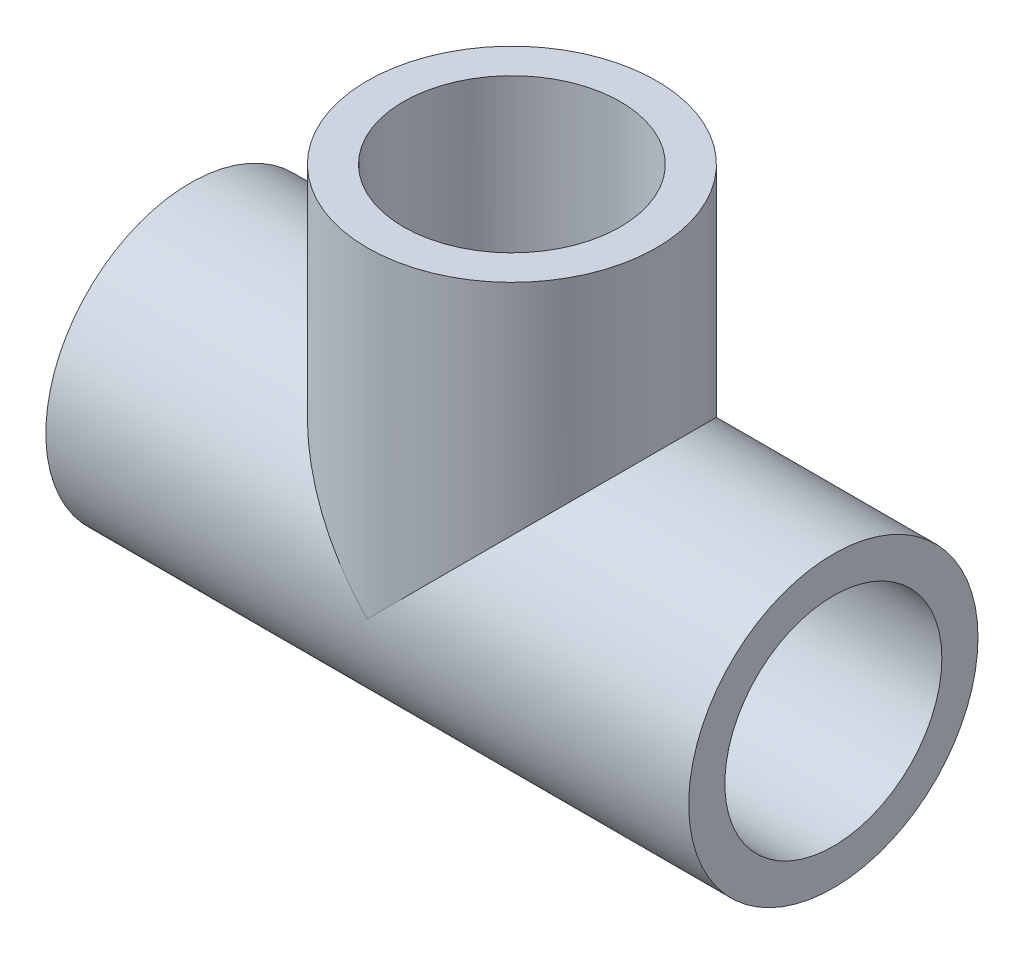
from build123d import *
from build123d.topology import SkipClean

# Parameters (mm, degrees)
SKETCH4_R              = 7.8613
CUT_EXTRUDE1_DEPTH     = 50.165
CUT_EXTRUDE2_OUTLINE_W = 7.8613
CUT_EXTRUDE2_OUTLINE_H = 10.71591219


# Read off the part's stored shape, not the designer's step: Cut-Extrude2
with BuildPart() as part:
    # Sketch1 → Revolve1 (revolve)
    with BuildSketch(Plane.XY, mode=Mode.PRIVATE) as revolve1_sk:
        Polygon((-23.8125, 10.715625), (23.8125, 10.715625), (23.8125, 8.0391), (10.31875, 8.0391), (10.31875, 7.8613), (-10.31875, 7.8613), (-10.31875, 8.0391), (-23.8125, 8.0391), align=None)
    revolve(revolve1_sk.sketch.rotate(Axis((38.116724739, 0, 0), (-1, 0, 0)), 90), axis=Axis((38.116724739, 0, 0), (-1, 0, 0)))

    # Sketch3 → Revolve2 (revolve)
    with BuildSketch(Plane.XY, mode=Mode.PRIVATE) as revolve2_sk:
        Polygon((8.0391, 23.8125), (10.715625, 23.8125), (10.715625, 0), (7.8613, 0), (7.8613, 10.31875), (8.0391, 10.31875), align=None)
    revolve(revolve2_sk.sketch.rotate(Axis((0, 32.756669959, 0), (0, -1, 0)), 90), axis=Axis((0, 32.756669959, 0), (0, -1, 0)))

    # Sketch4 → Cut-Extrude1 (cut)
    with BuildSketch(Plane.ZY.offset(26.3525)):
        with Locations(Location((0, 0, 0), (0, 0, 68.436398303))):
            Circle(SKETCH4_R)
    extrude(amount=-CUT_EXTRUDE1_DEPTH, mode=Mode.SUBTRACT)

    # Cut-Extrude2 outline → Cut-Extrude2 (revolve, cut)
    with SkipClean():  # the faces are left unmerged after this step: merging them gives an invalid solid
        with BuildSketch(Plane.XY):
            with Locations((3.93065, 5.357956095)):
                Rectangle(CUT_EXTRUDE2_OUTLINE_W, CUT_EXTRUDE2_OUTLINE_H)
        revolve(axis=Axis((0, 0, 0), (0, 1, 0)), mode=Mode.SUBTRACT)


solid = part.part
